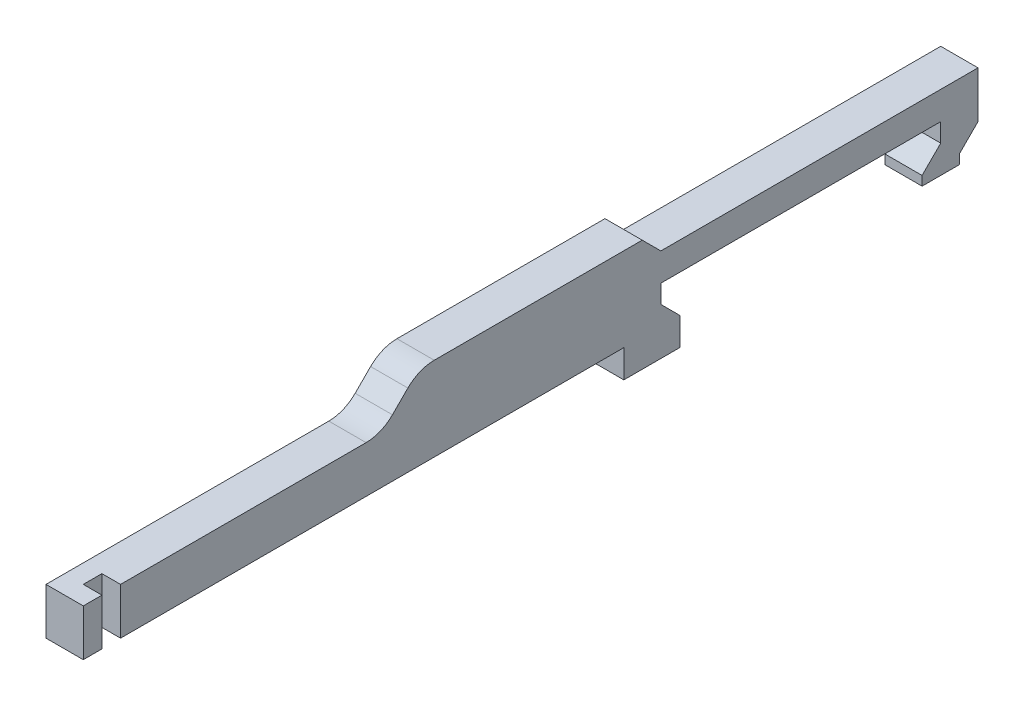
from build123d import *

# Parameters (mm, degrees)
EXTRUDE_1_DEPTH     = 2
FILLET_1_R          = 2
SKETCH_2_W          = 1
SKETCH_2_H          = 1
CUT_EXTRUDE_1_DEPTH = 49.207883173
CUT_EXTRUDE_2_DEPTH = 49.251942966


with BuildPart() as part:
    # Эскиз1 → Бобышка-Вытянуть1 (new body)
    with BuildSketch(Plane(origin=(0, 0, 0), x_dir=(0, 0, -1), z_dir=(1, 0, 0))):
        Polygon((0, 0), (29, 0), (29, -1.5), (32, -1.5), (32, 0), (31, 1), (31, 2), (46, 2), (46, 1), (45, 0), (45, -0.5), (47, -0.5), (47, 0), (48, 1), (48, 4.5), (18, 4.5), (16, 2.5), (0, 2.5), align=None)
    extrude(amount=EXTRUDE_1_DEPTH)

    # Скругление1
    fillet_1_edges = [part.edges().sort_by_distance(p)[0] for p in [
        (1, 4.5, -18),
        (1, 2.5, -16),
    ]]
    fillet(fillet_1_edges, radius=FILLET_1_R)

    # Эскиз2 → Вырез-Вытянуть1 (cut, through all)
    with BuildSketch(Plane(origin=(0, 2.5, 0), x_dir=(1, 0, 0), z_dir=(0, 1, 0))):
        with Locations((1.5, 1.5)):
            Rectangle(SKETCH_2_W, SKETCH_2_H)
    extrude(amount=-CUT_EXTRUDE_1_DEPTH, mode=Mode.SUBTRACT)

    # Эскиз3 → Вырез-Вытянуть2 (cut, through all)
    with BuildSketch(Plane(origin=(2, 0, 0), x_dir=(0, 0, -1), z_dir=(1, 0, 0))):
        Polygon((48, 4.5), (48, 3.5), (30.98631983, 3.5), (29.98631983, 4.5), (30.98631983, 4.5), align=None)
    extrude(amount=-CUT_EXTRUDE_2_DEPTH, mode=Mode.SUBTRACT)


solid = part.part
